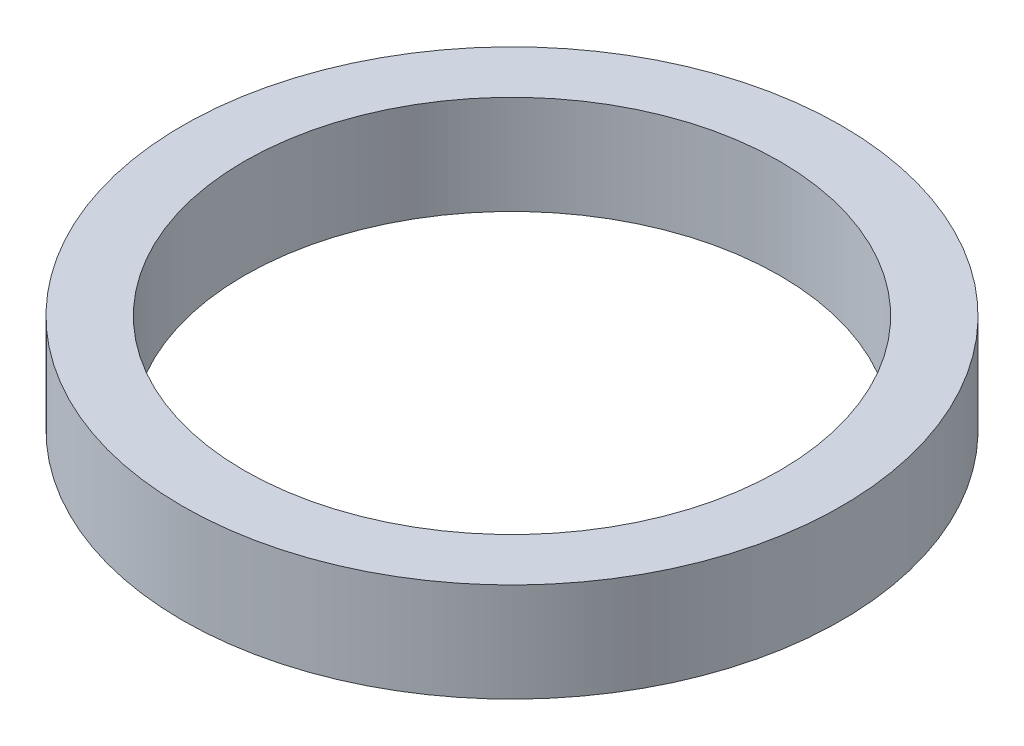
from build123d import *

# Parameters (mm, degrees)
SKETCH1_R           = 40
BOSS_EXTRUDE1_DEPTH = 12
SKETCH2_R           = 32.5
CUT_EXTRUDE1_DEPTH  = 58.827329179


with BuildPart() as part:
    # Sketch1 → Boss-Extrude1 (new body)
    with BuildSketch(Plane(origin=(0, 0, 0), x_dir=(1, 0, 0), z_dir=(0, 1, 0))):
        Circle(SKETCH1_R)
    extrude(amount=BOSS_EXTRUDE1_DEPTH)

    # Sketch2 → Cut-Extrude1 (cut, through all)
    with BuildSketch(Plane(origin=(0, 0, 0), x_dir=(1, 0, 0), z_dir=(0, 1, 0))):
        Circle(SKETCH2_R)
    extrude(amount=CUT_EXTRUDE1_DEPTH, mode=Mode.SUBTRACT)


solid = part.part
